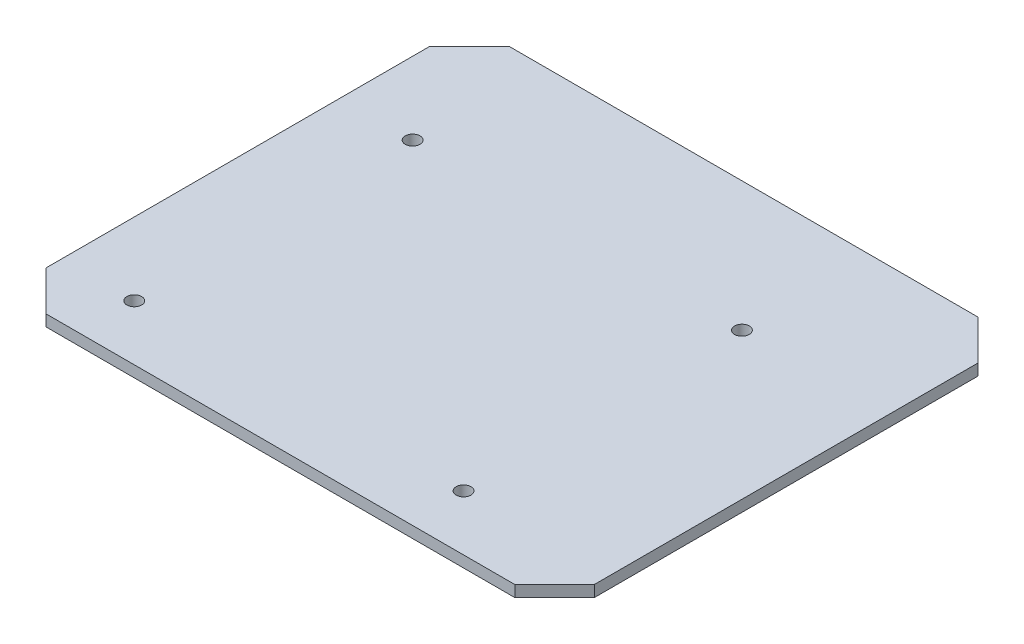
from build123d import *

# Parameters (mm, degrees)
EXTRUDE_1_DEPTH     = 2
CUT_EXTRUDE_1_REACH = 72.175
SKETCH_2_R          = 1.3


with BuildPart() as part:
    # 草图1 → 凸台-拉伸1 (new body)
    with BuildSketch(Plane.XZ.offset(19.39)):
        Polygon((-51.8, -40.295836944), (-44.795836944, -47.3), (37.795836944, -47.3), (44.8, -40.295836944), (44.8, 27.295836944), (37.795836944, 34.3), (-44.795836944, 34.3), (-51.8, 27.295836944), align=None)
    extrude(amount=EXTRUDE_1_DEPTH)

    # 草图2 → 切除-拉伸1 (cut, up to next)
    with BuildSketch(Plane.XZ.offset(21.39), mode=Mode.PRIVATE) as cut_extrude_1_sk1:
        with Locations((-39.011567772, -24.5)):
            Circle(SKETCH_2_R)
    cut_extrude_1_tool1 = extrude(cut_extrude_1_sk1.sketch, amount=-CUT_EXTRUDE_1_REACH, mode=Mode.PRIVATE) & part.part
    # 草图2 → 切除-拉伸1 (cut, up to next)
    with BuildSketch(Plane.XZ.offset(21.39), mode=Mode.PRIVATE) as cut_extrude_1_sk2:
        with Locations((19, -24.5)):
            Circle(SKETCH_2_R)
    cut_extrude_1_tool2 = extrude(cut_extrude_1_sk2.sketch, amount=-CUT_EXTRUDE_1_REACH, mode=Mode.PRIVATE) & part.part
    # 草图2 → 切除-拉伸1 (cut, up to next)
    with BuildSketch(Plane.XZ.offset(21.39), mode=Mode.PRIVATE) as cut_extrude_1_sk3:
        with Locations((-39.011567772, 24.535212594)):
            Circle(SKETCH_2_R)
    cut_extrude_1_tool3 = extrude(cut_extrude_1_sk3.sketch, amount=-CUT_EXTRUDE_1_REACH, mode=Mode.PRIVATE) & part.part
    # 草图2 → 切除-拉伸1 (cut, up to next)
    with BuildSketch(Plane.XZ.offset(21.39), mode=Mode.PRIVATE) as cut_extrude_1_sk4:
        with Locations((19, 24.535212594)):
            Circle(SKETCH_2_R)
    cut_extrude_1_tool4 = extrude(cut_extrude_1_sk4.sketch, amount=-CUT_EXTRUDE_1_REACH, mode=Mode.PRIVATE) & part.part
    add(cut_extrude_1_tool1.solids().sort_by_distance((-39.011568, -21.39, -24.5))[0], mode=Mode.SUBTRACT)
    add(cut_extrude_1_tool2.solids().sort_by_distance((19, -21.39, -24.5))[0], mode=Mode.SUBTRACT)
    add(cut_extrude_1_tool3.solids().sort_by_distance((-39.011568, -21.39, 24.535213))[0], mode=Mode.SUBTRACT)
    add(cut_extrude_1_tool4.solids().sort_by_distance((19, -21.39, 24.535213))[0], mode=Mode.SUBTRACT)


solid = part.part
